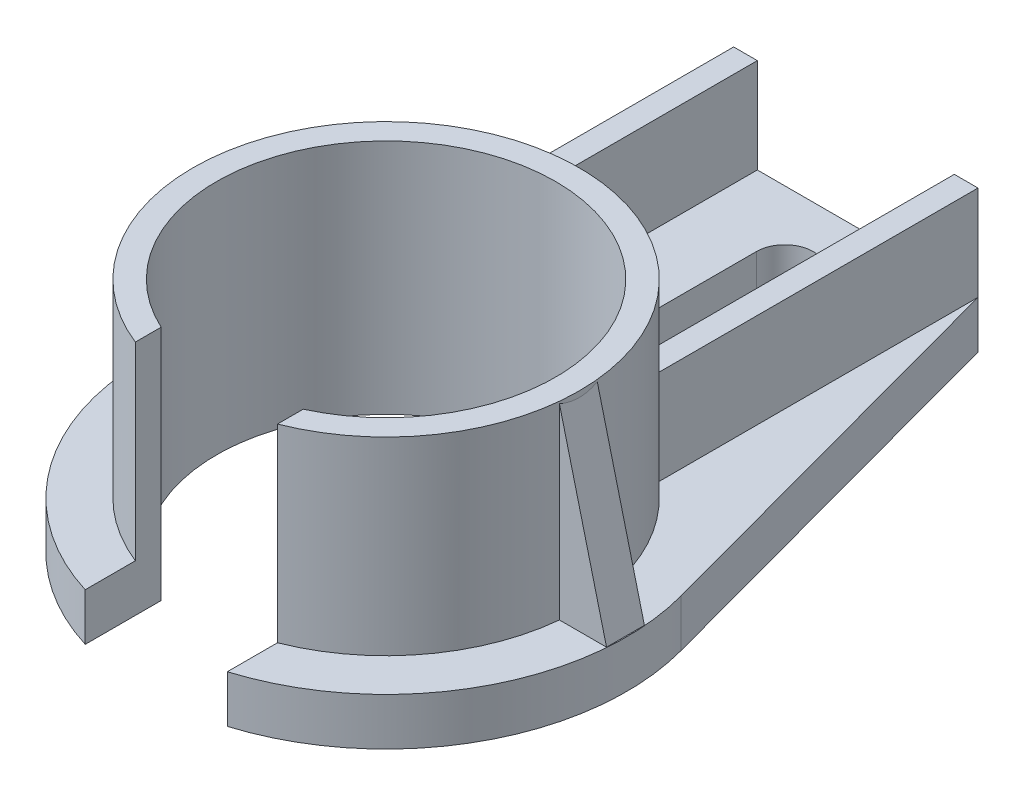
from build123d import *

# Parameters (mm, degrees)
SKETCH8_R           = 11.3665
BOSS_EXTRUDE3_DEPTH = 3.175
SKETCH9_R           = 12.954
SKETCH9_R_2         = 11.3665
BOSS_EXTRUDE4_DEPTH = 12.7
RIB12_REACH         = 40.783
SKETCH13_WALL_W     = 92.662520058
SKETCH13_WALL_H     = 2.54
CUT_EXTRUDE1_DEPTH  = 52.861115163
RIB1_START          = -47.625
RIB1_OUTLINE_W      = 1.5875
RIB1_OUTLINE_H      = 6.35
RIB1_DEPTH          = 21.4607898
SKETCH16_W          = 9.525
SKETCH16_H          = 15.588386278
CUT_EXTRUDE3_DEPTH  = 53.72855859


# Read off the part's stored shape, not the designer's step: Rib1
with BuildPart() as part:
    # Sketch8 → Boss-Extrude3 (new body)
    with BuildSketch(Plane(origin=(0, 0, 0), x_dir=(1, 0, 0), z_dir=(0, 1, 0))):
        with BuildLine():
            Line((-8.1915, 47.625), (8.1915, 47.625))
            Line((8.1915, 47.625), (15.569804863, 20.339203977))
            ThreePointArc((15.569804863, 20.339203977), (0, 0), (-15.569804863, 20.339203977))
            Line((-15.569804863, 20.339203977), (-8.1915, 47.625))
        make_face()
        with Locations(Location((0, 16.129, 0), (0, 0, 270))):
            Circle(SKETCH8_R, mode=Mode.SUBTRACT)
    extrude(amount=BOSS_EXTRUDE3_DEPTH)

    # Sketch9 → Boss-Extrude4 (add)
    with BuildSketch(Plane(origin=(0, 3.175, 0), x_dir=(1, 0, 0), z_dir=(0, 1, 0))):
        with Locations(Location((0, 16.129, 0), (0, 0, 270))):
            Circle(SKETCH9_R)
        with Locations(Location((0, 16.129, 0), (0, 0, 270))):
            Circle(SKETCH9_R_2, mode=Mode.SUBTRACT)
    extrude(amount=BOSS_EXTRUDE4_DEPTH)

    # Sketch13 wall → Rib12 (add, up to next)
    with BuildSketch(Plane(origin=(-14.453521799, 9.525, -16.129), x_dir=(-0.243924343996, -0.969794263958, 0), z_dir=(0.969794263958, -0.243924343996, 0)), mode=Mode.PRIVATE) as rib12_sk1:
        Rectangle(SKETCH13_WALL_W, SKETCH13_WALL_H)
    rib12_tool1 = extrude(rib12_sk1.sketch, amount=RIB12_REACH, mode=Mode.PRIVATE) - part.part
    rib12 = rib12_tool1.solids().sort_by_distance((-14.453521799, 9.525, -16.129))[0]
    add(rib12)

    # Mirror2: Rib12 across plane
    add(rib12.mirror(Plane(origin=(0, 0, 0), x_dir=(0, 0, 1), z_dir=(1, 0, 0))))

    # Sketch11 → Cut-Extrude1 (cut, through all)
    with BuildSketch(Plane(origin=(0, 3.175, 0), x_dir=(1, 0, 0), z_dir=(0, 1, 0))):
        with BuildLine():
            Line((1.89865, 42.8625), (1.89865, 35.433))
            ThreePointArc((1.89865, 35.433), (0, 33.53435), (-1.89865, 35.433))
            Line((-1.89865, 35.433), (-1.89865, 42.8625))
            ThreePointArc((-1.89865, 42.8625), (0, 44.76115), (1.89865, 42.8625))
        make_face()
    extrude(amount=-CUT_EXTRUDE1_DEPTH, mode=Mode.SUBTRACT)

    # Rib1 outline → Rib1 (add)
    with BuildSketch(Plane.XY.offset(RIB1_START)):
        with Locations((-7.39775, 6.35)):
            Rectangle(RIB1_OUTLINE_W, RIB1_OUTLINE_H)
    rib1 = extrude(amount=RIB1_DEPTH)

    # Mirror1: Rib1 across plane
    add(rib1.mirror(Plane(origin=(0, 0, 0), x_dir=(0, 0, 1), z_dir=(1, 0, 0))))

    # Sketch16 → Cut-Extrude3 (cut, through all)
    with BuildSketch(Plane(origin=(0, 0, 0), x_dir=(1, 0, 0), z_dir=(0, 1, 0))):
        Rectangle(SKETCH16_W, SKETCH16_H)
    extrude(amount=CUT_EXTRUDE3_DEPTH, mode=Mode.SUBTRACT)


solid = part.part
